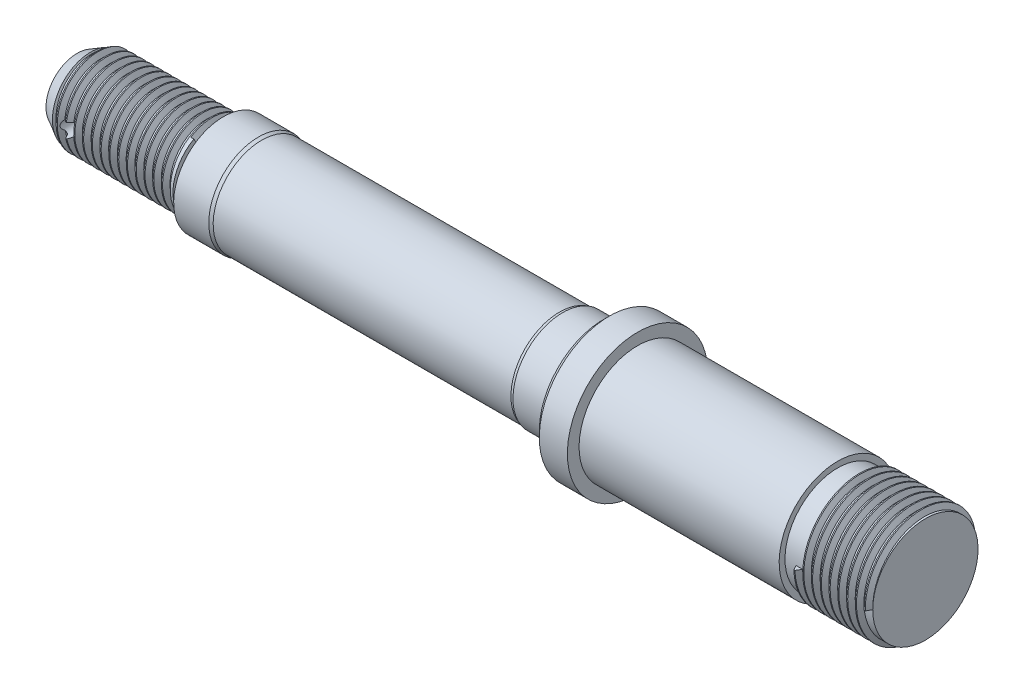
from build123d import *
from build123d.topology import SkipClean

# Parameters (mm, degrees)
THREAD1_PITCH           = 1.5
SKETCH30_R              = 7.14375
BOSS_EXTRUDE1_DEPTH     = 25
CUT_EXTRUDE1_DEPTH      = 122.301310815
CUT_EXTRUDE1_DEPTH_BACK = 122.301310815
SKETCH35_R              = 1.190625
SKETCH36_W              = 1.479856422
SKETCH36_H              = 4.224470207
THREAD3_PITCH           = 1.5


with BuildPart() as part:
    # Sketch1 → Revolve1 (revolve)
    with BuildSketch(Plane.XY, mode=Mode.PRIVATE) as revolve1_sk:
        Polygon((0.102318215, 8.441826997), (0.102318215, -0.058173003), (27.102318215, -0.058173003), (34.173386027, -0.058173003), (120.102318215, -0.058173003), (120.102318215, 8.941826997), (108.102318215, 8.941826997), (105.102318215, 8.941826997), (105.102318215, 9.941826997), (93.327883988, 9.941826997), (87.458915587, 9.941826997), (70.902318215, 9.941826997), (70.902318215, 11.941826997), (66.102318215, 11.941826997), (65.102318215, 10.941826997), (65.102318215, 8.441826997), (58.102318215, 8.441826997), (57.552318215, 8.241826997), (6.652318215, 8.241826997), (6.102318215, 8.441826997), align=None)
    revolve(revolve1_sk.sketch.rotate(Axis((34.173386027, -0.058173003, 0), (1, 0, 0)), 180), axis=Axis((34.173386027, -0.058173003, 0), (1, 0, 0)))

    # Thread1: the profile of Thread Profile6 profile screwed along a right-hand helix of 8 turns, 8 arcs to a turn; built about Z, then put on its axis
    with SkipClean():  # the faces are left unmerged after this step: merging them gives an invalid solid
        thread1_z = Axis((0, 0, 0), (0, 0, 1))
        thread1_corners = [(8.9997, 0, -0.000173205), (9.811898813, 0, 0.468749998), (9.811898813, 0, 0.656249998), (8.9997, 0, 1.125173201)]
        with BuildLine(mode=Mode.PRIVATE) as thread1_profile:
            Line(thread1_corners[0], thread1_corners[1])
            Line(thread1_corners[1], thread1_corners[2])
            Line(thread1_corners[2], thread1_corners[3])
            Line(thread1_corners[3], thread1_corners[0])
        thread1_cap = Face(thread1_profile.wire())
        thread1_turn_angles = [0, 22.5, 45, 67.5, 90, 112.5, 135, 157.5, 180, 202.5, 225, 247.5, 270, 292.5, 315, 337.5, 360]
        thread1_turn_weights = [1, 0.9238795325112867, 1, 0.9238795325112867, 1, 0.9238795325112867, 1, 0.9238795325112867, 1, 0.9238795325112867, 1, 0.9238795325112867, 1, 0.9238795325112867, 1, 0.9238795325112867, 1]
        thread1_turn_rails = [Edge.make_bspline([Vector(p[0], p[1], 0).rotate(thread1_z, thread1_turn_angles[k]) / thread1_turn_weights[k] + Vector(0, 0, p[2] + THREAD1_PITCH * thread1_turn_angles[k] / 360) for k in range(17)], [0, 0, 0, 1, 1, 2, 2, 3, 3, 4, 4, 5, 5, 6, 6, 7, 7, 8, 8, 8], 2, thread1_turn_weights) for p in thread1_corners]
        thread1_turn_sides = [Face.make_surface_from_curves(thread1_turn_rails[p[0]], thread1_turn_rails[p[1]]) for p in [(0, 1), (1, 2), (2, 3), (3, 0)]]
        thread1 = Plane(origin=(120.102318215, -0.058173003, 0), x_dir=(0, 0, 1), z_dir=(-1, 0, 0)) * Solid(Shell([*[p.moved(Location((0, 0, THREAD1_PITCH * i))) for i in range(8) for p in thread1_turn_sides], thread1_cap, thread1_cap.rotate(thread1_z, 2880).moved(Location((0, 0, THREAD1_PITCH * 2880 / 360)))]))
        add(thread1)

    # Sketch30 → Boss-Extrude1 (add)
    with SkipClean():  # the faces are left unmerged after this step: merging them gives an invalid solid
        with BuildSketch(Plane.ZY.offset(-0.102318215)):
            with Locations(Location((0, 0, 0), (0, 0, 270))):
                Circle(SKETCH30_R)
        extrude(amount=BOSS_EXTRUDE1_DEPTH)

    # Sketch35 → Cut-Extrude1 (cut, two sides: drawn at the far end of the back side and taken through both)
    with SkipClean():  # the faces are left unmerged after this step: merging them gives an invalid solid
        with BuildSketch(Plane.XY.offset(-CUT_EXTRUDE1_DEPTH_BACK)):
            with Locations((-19.785674248, 0)):
                Circle(SKETCH35_R)
        extrude(amount=CUT_EXTRUDE1_DEPTH + CUT_EXTRUDE1_DEPTH_BACK, mode=Mode.SUBTRACT)

    # Sketch36 → Cut-Revolve1 (revolve, cut)
    with SkipClean():  # the faces are left unmerged after this step: merging them gives an invalid solid
        with BuildSketch(Plane.XY, mode=Mode.PRIVATE) as cut_revolve1_sk:
            with Locations((-0.637609996, 6.003683336)):
                Rectangle(SKETCH36_W, SKETCH36_H)
        revolve(cut_revolve1_sk.sketch.rotate(Axis((0, 0, 0), (1, 0, 0)), 270), axis=Axis((0, 0, 0), (1, 0, 0)), mode=Mode.SUBTRACT)

    # Thread3: the profile of Thread Profile9 profile screwed along a right-hand helix of 15.333333 turns, 8 arcs to a turn; built about Z, then put on its axis
    with SkipClean():  # the faces are left unmerged after this step: merging them gives an invalid solid
        thread3_z = Axis((0, 0, 0), (0, 0, 1))
        thread3_corners = [(7.14405, 0, -0.000173205), (7.14405, 0, 1.312673201), (6.331851188, 0, 0.843749998), (6.331851188, 0, 0.468749998)]
        with BuildLine(mode=Mode.PRIVATE) as thread3_profile:
            Line(thread3_corners[0], thread3_corners[1])
            Line(thread3_corners[1], thread3_corners[2])
            Line(thread3_corners[2], thread3_corners[3])
            Line(thread3_corners[3], thread3_corners[0])
        thread3_cap = Face(thread3_profile.wire())
        thread3_turn_angles = [0, 22.5, 45, 67.5, 90, 112.5, 135, 157.5, 180, 202.5, 225, 247.5, 270, 292.5, 315, 337.5, 360]
        thread3_turn_weights = [1, 0.9238795325112867, 1, 0.9238795325112867, 1, 0.9238795325112867, 1, 0.9238795325112867, 1, 0.9238795325112867, 1, 0.9238795325112867, 1, 0.9238795325112867, 1, 0.9238795325112867, 1]
        thread3_turn_rails = [Edge.make_bspline([Vector(p[0], p[1], 0).rotate(thread3_z, thread3_turn_angles[k]) / thread3_turn_weights[k] + Vector(0, 0, p[2] + THREAD3_PITCH * thread3_turn_angles[k] / 360) for k in range(17)], [0, 0, 0, 1, 1, 2, 2, 3, 3, 4, 4, 5, 5, 6, 6, 7, 7, 8, 8, 8], 2, thread3_turn_weights) for p in thread3_corners]
        thread3_turn_sides = [Face.make_surface_from_curves(thread3_turn_rails[p[0]], thread3_turn_rails[p[1]]) for p in [(0, 1), (1, 2), (2, 3), (3, 0)]]
        thread3_last_angles = [5400, 5422.5, 5445, 5467.5, 5490, 5505, 5520]
        thread3_last_weights = [1, 0.9238795325112867, 1, 0.9238795325112867, 1, 0.9659258262890703, 1]
        thread3_last_rails = [Edge.make_bspline([Vector(p[0], p[1], 0).rotate(thread3_z, thread3_last_angles[k]) / thread3_last_weights[k] + Vector(0, 0, p[2] + THREAD3_PITCH * thread3_last_angles[k] / 360) for k in range(7)], [0, 0, 0, 1, 1, 2, 2, 3, 3, 3], 2, thread3_last_weights) for p in thread3_corners]
        thread3_last_sides = [Face.make_surface_from_curves(thread3_last_rails[p[0]], thread3_last_rails[p[1]]) for p in [(0, 1), (1, 2), (2, 3), (3, 0)]]
        thread3 = Plane(origin=(-24.897681785, 0, 0), x_dir=(0, 0, -1), z_dir=(1, 0, 0)) * Solid(Shell([*[p.moved(Location((0, 0, THREAD3_PITCH * i))) for i in range(15) for p in thread3_turn_sides], *thread3_last_sides, thread3_cap, thread3_cap.rotate(thread3_z, 5520).moved(Location((0, 0, THREAD3_PITCH * 5520 / 360)))]))
        add(thread3, mode=Mode.SUBTRACT)

    # Sketch45 → Cut-Revolve2 (revolve, cut)
    with SkipClean():  # the faces are left unmerged after this step: merging them gives an invalid solid
        with BuildSketch(Plane(origin=(0, 0, 0), x_dir=(1, 0, 0), z_dir=(0, 1, 0)), mode=Mode.PRIVATE) as cut_revolve2_sk:
            Polygon((-29.483303149, 10.141312288), (-28.982907444, 3.044791381), (-21.158538239, 7.41188117), align=None)
        revolve(cut_revolve2_sk.sketch.rotate(Axis((0, 0, 0), (1, 0, 0)), 320.674834798), axis=Axis((0, 0, 0), (1, 0, 0)), mode=Mode.SUBTRACT)


solid = part.part
